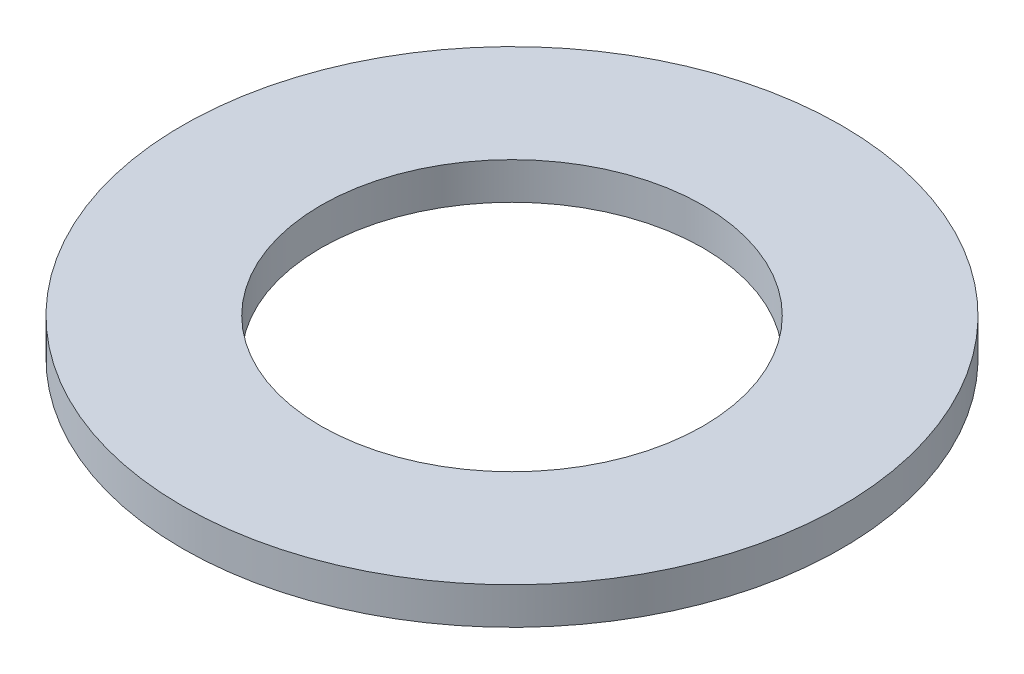
from build123d import *

# Parameters (mm, degrees)
SKETCH1_R           = 22.225
BOSS_EXTRUDE1_DEPTH = 2.4892
SKETCH5_R           = 12.8905
CUT_EXTRUDE1_DEPTH  = 32.529309644


with BuildPart() as part:
    # Sketch1 → Boss-Extrude1 (new body)
    with BuildSketch(Plane(origin=(0, 0, 0), x_dir=(1, 0, 0), z_dir=(0, 1, 0))):
        Circle(SKETCH1_R)
    extrude(amount=BOSS_EXTRUDE1_DEPTH)

    # Sketch5 → Cut-Extrude1 (cut, through all)
    with BuildSketch(Plane(origin=(0, 2.4892, 0), x_dir=(-1, 0, 0), z_dir=(0, 1, 0))):
        Circle(SKETCH5_R)
    extrude(amount=-CUT_EXTRUDE1_DEPTH, mode=Mode.SUBTRACT)


solid = part.part
